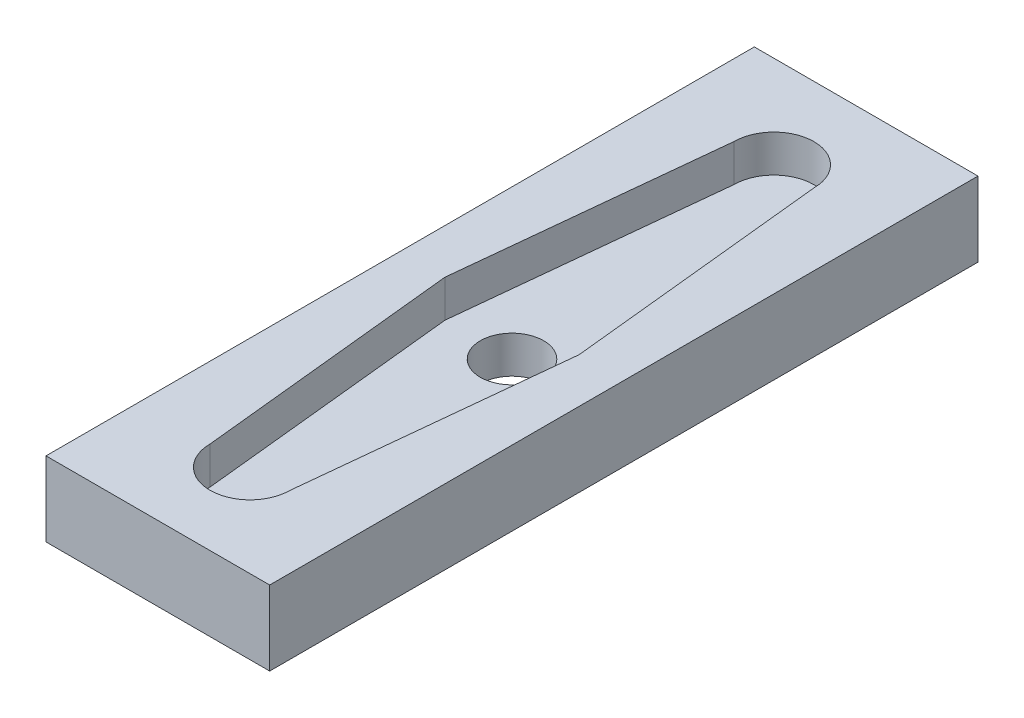
from build123d import *

# Parameters (mm, degrees)
SKETCH1_W           = 20
SKETCH1_H           = 50
BOSS_EXTRUDE2_DEPTH = 4
CUT_EXTRUDE1_DEPTH  = 2
SKETCH4_W           = 20
SKETCH4_H           = 50
SKETCH4_W_2         = 12
SKETCH4_H_2         = 38
CUT_EXTRUDE2_DEPTH  = 55
SKETCH5_R           = 1.7
CUT_EXTRUDE3_DEPTH  = 2


with BuildPart() as part:
    # Sketch1 → Boss-Extrude2 (new body)
    with BuildSketch(Plane(origin=(0, 0, 0), x_dir=(1, 0, 0), z_dir=(0, 1, 0))):
        with Locations((10, 25)):
            Rectangle(SKETCH1_W, SKETCH1_H)
    extrude(amount=BOSS_EXTRUDE2_DEPTH)

    # Sketch3 → Cut-Extrude1 (cut)
    with BuildSketch(Plane(origin=(0, 4, 0), x_dir=(1, 0, 0), z_dir=(0, 1, 0))):
        with BuildLine():
            Line((7.85, 10.95), (6.4, 25))
            Line((6.4, 25), (7.85, 39.05))
            ThreePointArc((7.85, 39.05), (10, 41.2), (12.15, 39.05))
            Line((12.15, 39.05), (13.6, 25))
            Line((13.6, 25), (12.15, 10.95))
            ThreePointArc((12.15, 10.95), (10, 8.8), (7.85, 10.95))
        make_face()
    extrude(amount=-CUT_EXTRUDE1_DEPTH, mode=Mode.SUBTRACT)

    # Sketch4 → Cut-Extrude2 (cut, through all)
    with BuildSketch(Plane(origin=(0, 4, 0), x_dir=(1, 0, 0), z_dir=(0, 1, 0))):
        with Locations((10, 25)):
            Rectangle(SKETCH4_W, SKETCH4_H)
        with Locations((10, 25)):
            Rectangle(SKETCH4_W_2, SKETCH4_H_2, mode=Mode.SUBTRACT)
    extrude(amount=-CUT_EXTRUDE2_DEPTH, mode=Mode.SUBTRACT)

    # Sketch5 → Cut-Extrude3 (cut)
    with BuildSketch(Plane(origin=(0, 2, 0), x_dir=(1, 0, 0), z_dir=(0, 1, 0))):
        with Locations((10, 25)):
            Circle(SKETCH5_R)
    extrude(amount=-CUT_EXTRUDE3_DEPTH, mode=Mode.SUBTRACT)


solid = part.part
